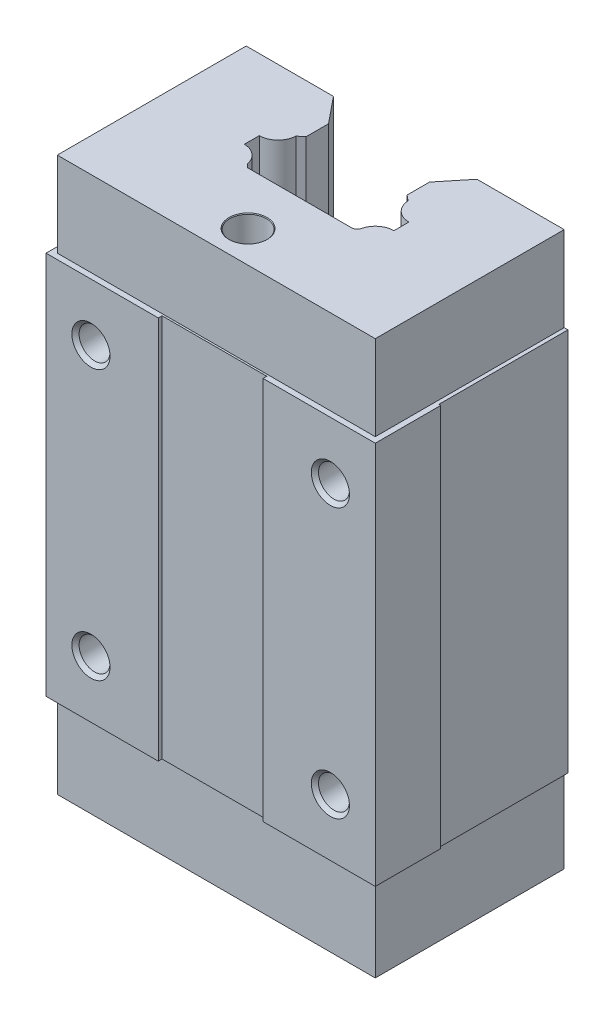
from build123d import *

# Parameters (mm, degrees)
SKIZZE1_W                       = 44
SKIZZE1_H                       = 51.3
AUFSATZ_LINEAR_AUSTRAGEN1_DEPTH = 26
SKIZZE2_W                       = 0.25
SKIZZE2_H                       = 17.25
SCHNITT_LINEAR_AUSTRAGEN1_DEPTH = 64.369472146
SKIZZE3_W                       = 14
SKIZZE3_H                       = 0.5
SCHNITT_LINEAR_AUSTRAGEN2_DEPTH = 64.369472146
SKIZZE4_W                       = 0.25
SKIZZE4_H                       = 17.25
SCHNITT_LINEAR_AUSTRAGEN3_DEPTH = 51.3
SKIZZE5_W                       = 42.5
SKIZZE5_H                       = 25.25
AUFSATZ_LINEAR_AUSTRAGEN2_DEPTH = 11.35
SKIZZE6_W                       = 42.5
SKIZZE6_H                       = 25.25
AUFSATZ_LINEAR_AUSTRAGEN3_DEPTH = 11.35
SCHNITT_LINEAR_AUSTRAGEN4_DEPTH = 83.825116963
BOHRUNG1_D                      = 4.917
BOHRUNG1_DEPTH                  = 15
BOHRUNG1_TIP                    = 1.477215832
BOHRUNG2_D                      = 4.917
BOHRUNG2_DEPTH                  = 15
BOHRUNG2_TIP                    = 1.477215832
DURCHGANGSLOCH_F_R_M3_51_D      = 4.134
DURCHGANGSLOCH_F_R_M3_51_DEPTH  = 6
DURCHGANGSLOCH_F_R_M3_51_TIP    = 1.2419789
FASE1_SIZE                      = 0.483
FASE2_SIZE                      = 0.448979592
FASE3_SIZE                      = 0.0915
FASE4_SIZE                      = 0.448979592


with BuildPart() as part:
    # Skizze1 → Aufsatz-Linear austragen1 (new body)
    with BuildSketch(Plane(origin=(0, 0, 4), x_dir=(-1, 0, 0), z_dir=(0, 0, -1))):
        Rectangle(SKIZZE1_W, SKIZZE1_H)
    extrude(amount=-AUFSATZ_LINEAR_AUSTRAGEN1_DEPTH)

    # Skizze2 → Schnitt-Linear austragen1 (cut, through all)
    with BuildSketch(Plane.XZ.offset(25.65)):
        with Locations((-21.875, 12.625)):
            Rectangle(SKIZZE2_W, SKIZZE2_H)
    extrude(amount=-SCHNITT_LINEAR_AUSTRAGEN1_DEPTH, mode=Mode.SUBTRACT)

    # Skizze3 → Schnitt-Linear austragen2 (cut, through all)
    with BuildSketch(Plane.XZ.offset(25.65)):
        with Locations((0, 29.75)):
            Rectangle(SKIZZE3_W, SKIZZE3_H)
    extrude(amount=-SCHNITT_LINEAR_AUSTRAGEN2_DEPTH, mode=Mode.SUBTRACT)

    # Skizze4 → Schnitt-Linear austragen3 (cut)
    with BuildSketch(Plane.XZ.offset(25.65)):
        with Locations((21.875, 12.625)):
            Rectangle(SKIZZE4_W, SKIZZE4_H)
    extrude(amount=-SCHNITT_LINEAR_AUSTRAGEN3_DEPTH, mode=Mode.SUBTRACT)

    # Skizze5 → Aufsatz-Linear austragen2 (add)
    with BuildSketch(Plane(origin=(0, 25.65, 0), x_dir=(-1, 0, 0), z_dir=(0, 1, 0))):
        with Locations((0, 16.625)):
            Rectangle(SKIZZE5_W, SKIZZE5_H)
    extrude(amount=AUFSATZ_LINEAR_AUSTRAGEN2_DEPTH)

    # Skizze6 → Aufsatz-Linear austragen3 (add)
    with BuildSketch(Plane.XZ.offset(25.65)):
        with Locations((0, 16.625)):
            Rectangle(SKIZZE6_W, SKIZZE6_H)
    extrude(amount=AUFSATZ_LINEAR_AUSTRAGEN3_DEPTH)

    # Skizze7 → Schnitt-Linear austragen4 (cut, through all)
    with BuildSketch(Plane.XZ.offset(37)):
        with BuildLine():
            Line((-9.59375, 4), (9.59375, 4))
            Line((9.59375, 4), (6.75, 7.5))
            Line((6.75, 7.5), (6.75, 10.5))
            Line((6.75, 10.5), (7.5, 11.109375))
            ThreePointArc((7.5, 11.109375), (8.270470592, 12.806156162), (10, 13.5))
            Line((10, 13.5), (10, 15.5))
            ThreePointArc((10, 15.5), (8.232233047, 16.232233047), (7.5, 18))
            Line((7.5, 18), (-7.5, 18))
            ThreePointArc((-7.5, 18), (-8.232233047, 16.232233047), (-10, 15.5))
            Line((-10, 15.5), (-10, 13.5))
            ThreePointArc((-10, 13.5), (-8.270470592, 12.806156162), (-7.5, 11.109375))
            Line((-7.5, 11.109375), (-6.75, 10.5))
            Line((-6.75, 10.5), (-6.75, 7.5))
            Line((-6.75, 7.5), (-9.59375, 4))
        make_face()
    extrude(amount=-SCHNITT_LINEAR_AUSTRAGEN4_DEPTH, mode=Mode.SUBTRACT)

    # Bohrung1
    with Locations(Plane(origin=(0, -37, 0), x_dir=(-1, 0, 0), z_dir=(0, -1, 0))):
        with Locations((0, -25)):
            Hole(BOHRUNG1_D / 2, depth=BOHRUNG1_DEPTH)
            with Locations((0, 0, -(BOHRUNG1_DEPTH + BOHRUNG1_TIP / 2))):  # 118° drill point
                Cone(0, BOHRUNG1_D / 2, BOHRUNG1_TIP, mode=Mode.SUBTRACT)

    # Bohrung2
    with Locations(Plane(origin=(0, 37, 0), x_dir=(1, 0, 0), z_dir=(0, 1, 0))):
        with Locations((0, -25)):
            Hole(BOHRUNG2_D / 2, depth=BOHRUNG2_DEPTH)
            with Locations((0, 0, -(BOHRUNG2_DEPTH + BOHRUNG2_TIP / 2))):  # 118° drill point
                Cone(0, BOHRUNG2_D / 2, BOHRUNG2_TIP, mode=Mode.SUBTRACT)

    # Durchgangsloch für M3.51
    with Locations(Plane.XY.offset(30)):
        with Locations((16, -18), (16, 18), (-16, 18), (-16, -18)):
            Hole(DURCHGANGSLOCH_F_R_M3_51_D / 2, depth=DURCHGANGSLOCH_F_R_M3_51_DEPTH)
            with Locations((0, 0, -(DURCHGANGSLOCH_F_R_M3_51_DEPTH + DURCHGANGSLOCH_F_R_M3_51_TIP / 2))):  # 118° drill point
                Cone(0, DURCHGANGSLOCH_F_R_M3_51_D / 2, DURCHGANGSLOCH_F_R_M3_51_TIP, mode=Mode.SUBTRACT)

    # Fase1
    fase1_edges = [part.edges().sort_by_distance(p)[0] for p in [
        (-13.933, -18, 30),
        (-13.933, 18, 30),
        (18.067, 18, 30),
        (18.067, -18, 30),
    ]]
    chamfer(fase1_edges, length=FASE1_SIZE)

    # Fase2
    # the kernel refuses this chamfer: 0.448979592, 0.406117321 mm, written as the material it adds along each edge
    with BuildSketch(Plane(origin=(-7.5, -37, 18), x_dir=(1, 0, 0), z_dir=(0, 1, 0))) as fase2_piece_1:
        with BuildLine():
            Line((FASE2_SIZE, 0), (-0.03932739, 0.441690284))
            ThreePointArc((-0.03932739, 0.441690284), (-0.010448273, 0.22832477), (0, 0))
            Line((0, 0), (FASE2_SIZE, 0))
        make_face()
    extrude(amount=74)

    # Fase3
    fase3_edges = [part.edges().sort_by_distance(p)[0] for p in [
        (-2.4585, -37, 25),
        (2.4585, 37, 25),
    ]]
    chamfer(fase3_edges, length=FASE3_SIZE)

    # Fase4
    # the kernel refuses this chamfer: 0.448979592, 0.406117321 mm, written as the material it adds along each edge
    with BuildSketch(Plane(origin=(7.5, -37, 18), x_dir=(0.08868753028202897, 0, -0.9960594972050988), z_dir=(0, 1, 0))) as fase4_piece_1:
        with BuildLine():
            Line((0.443437651, 0), (-FASE4_SIZE * 0.0886875302498, FASE4_SIZE * 0.996059496843))
            Line((-FASE4_SIZE * 0.0886875302498, FASE4_SIZE * 0.996059496843), (0, 0))
            ThreePointArc((0, 0), (0.228351687, 0.009842458), (0.443437651, 0))
        make_face()
    extrude(amount=74)


solid = part.part
